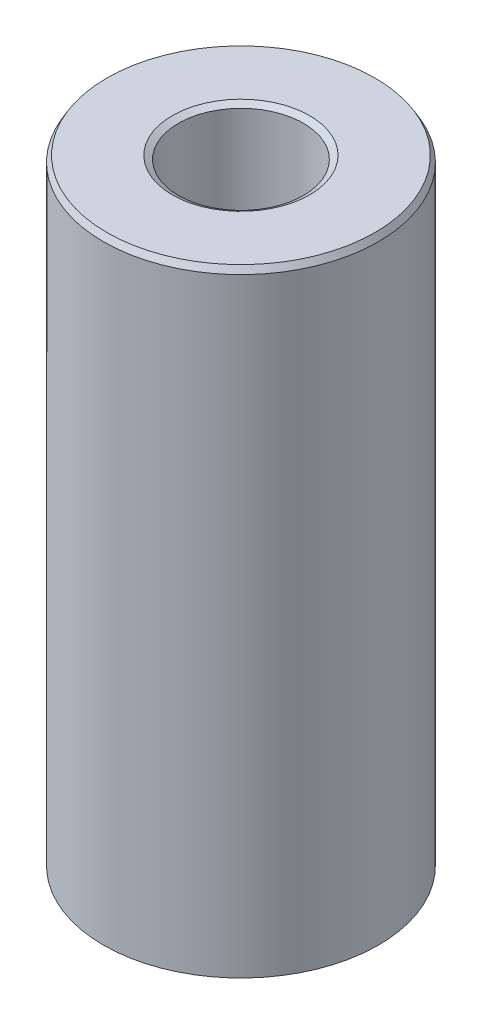
from build123d import *
from OCP.BRepFilletAPI import BRepFilletAPI_MakeChamfer

# Parameters (mm, degrees)
SKETCH1_R           = 45
BOSS_EXTRUDE1_DEPTH = 202.53894181
SKETCH2_R           = 20.466114854
CUT_EXTRUDE1_DEPTH  = 213.301726204
CHAMFER1_SIZE       = 2.011733842
CHAMFER1_SIZE2      = 1.161475075


with BuildPart() as part:
    # Sketch1 → Boss-Extrude1 (new body)
    with BuildSketch(Plane(origin=(0, 0, 0), x_dir=(1, 0, 0), z_dir=(0, 1, 0))):
        Circle(SKETCH1_R)
    extrude(amount=BOSS_EXTRUDE1_DEPTH)

    # Sketch2 → Cut-Extrude1 (cut, through all)
    with BuildSketch(Plane(origin=(0, 0, 0), x_dir=(1, 0, 0), z_dir=(0, 1, 0))):
        Circle(SKETCH2_R)
    extrude(amount=CUT_EXTRUDE1_DEPTH, mode=Mode.SUBTRACT)

    # Chamfer1: one chamfer whose edges measure the first distance from different faces: ONE call of the kernel's chamfer builder (chamfer() names one face for all edges)
    chamfer1_edges_1 = [part.edges().sort_by_distance(p)[0] for p in [
        (-20.466114854, 202.53894181, 0),
    ]]
    chamfer1_side_1 = [part.faces().sort_by_distance(p)[0] for p in [
        (-43.727207794, 202.53894181, 0),
    ]]
    chamfer1_edges_2 = [part.edges().sort_by_distance(p)[0] for p in [
        (-20.466114854, 0, 0),
    ]]
    chamfer1_side_2 = [part.faces().sort_by_distance(p)[0] for p in [
        (-20.466114854, 101.269470905, 0),
    ]]
    chamfer1_edges_3 = [part.edges().sort_by_distance(p)[0] for p in [
        (-45, 0, 0),
    ]]
    chamfer1_side_3 = [part.faces().sort_by_distance(p)[0] for p in [
        (-43.727207794, 0, 0),
    ]]
    chamfer1_edges_4 = [part.edges().sort_by_distance(p)[0] for p in [
        (-45, 202.53894181, 0),
    ]]
    chamfer1_side_4 = [part.faces().sort_by_distance(p)[0] for p in [
        (-45, 101.269470905, 0),
    ]]
    chamfer1 = BRepFilletAPI_MakeChamfer(part.part.solid().wrapped)
    for e in chamfer1_edges_1:
        chamfer1.Add(CHAMFER1_SIZE, CHAMFER1_SIZE2, e.wrapped, chamfer1_side_1[0].wrapped)  # the first distance lies on this face
    for e in chamfer1_edges_2:
        chamfer1.Add(CHAMFER1_SIZE, CHAMFER1_SIZE2, e.wrapped, chamfer1_side_2[0].wrapped)  # the first distance lies on this face
    for e in chamfer1_edges_3:
        chamfer1.Add(CHAMFER1_SIZE, CHAMFER1_SIZE2, e.wrapped, chamfer1_side_3[0].wrapped)  # the first distance lies on this face
    for e in chamfer1_edges_4:
        chamfer1.Add(CHAMFER1_SIZE, CHAMFER1_SIZE2, e.wrapped, chamfer1_side_4[0].wrapped)  # the first distance lies on this face
    add(Compound.cast(chamfer1.Shape()), mode=Mode.REPLACE)


solid = part.part
